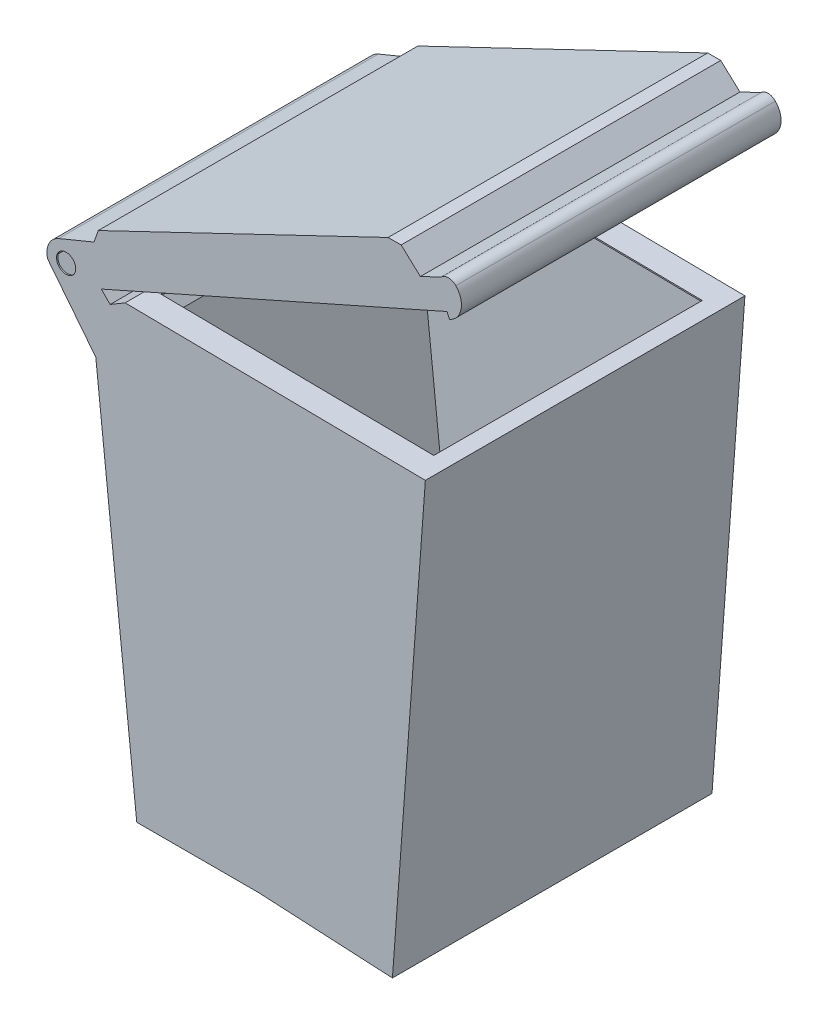
from build123d import *

# Parameters (mm, degrees)
BOSS_EXTRUDE1_DEPTH = 6.35
SHELL1_START        = 0.0254
SHELL1_DEPTH        = 6.2992
SKETCH3_W           = 5.418512696
SKETCH3_H           = 5.334
CUT_EXTRUDE2_DEPTH  = 1.524
SKETCH4_R           = 0.1905
CUT_EXTRUDE3_DEPTH  = 20.633989303


# Read off the part's stored shape, not the designer's step: Shell1
with BuildPart() as part:
    # Sketch1 → Boss-Extrude1 (new body)
    with BuildSketch(Plane.XY):
        with BuildLine():
            Line((7.716040042, 1.833305163), (10.375382868, 1.693751976))
            Line((10.375382868, 1.693751976), (11.029172055, 10.583751976))
            Line((11.029172055, 10.583751976), (5.064666493, 10.656097731))
            Line((5.064666493, 10.656097731), (4.767245057, 10.479252552))
            Line((4.767245057, 10.479252552), (4.590399878, 10.656097731))
            Line((4.590399878, 10.656097731), (11.46006589, 13.704368441))
            Line((11.46006589, 13.704368441), (11.509343406, 13.593315288))
            ThreePointArc((11.509343406, 13.593315288), (11.739536715, 13.882052013), (11.634947175, 14.236197299))
            ThreePointArc((11.634947175, 14.236197299), (11.492158572, 14.298396741), (11.347210136, 14.241411598))
            Line((11.347210136, 14.241411598), (10.931187512, 14.042030874))
            Line((10.931187512, 14.042030874), (10.548202312, 14.393751976))
            Line((10.548202312, 14.393751976), (10.290273504, 14.393751976))
            Line((10.290273504, 14.393751976), (4.530564215, 11.633385245))
            Line((4.530564215, 11.633385245), (4.445957531, 11.39304745))
            Line((4.445957531, 11.39304745), (3.74568803, 11.102479142))
            ThreePointArc((3.74568803, 11.102479142), (3.54655055, 10.911956466), (3.527947792, 10.636986353))
            Line((3.527947792, 10.636986353), (4.481389231, 9.429510304))
            Line((4.481389231, 9.429510304), (5.295382868, 1.833305163))
            Line((5.295382868, 1.833305163), (7.716040042, 1.833305163))
        make_face()
    extrude(amount=BOSS_EXTRUDE1_DEPTH)

    # Shell1 outline → Shell1 (cut)
    with BuildSketch(Plane.XY.offset(SHELL1_START)):
        with BuildLine():
            Line((5.318206472, 1.858705163), (7.716706036, 1.858705163))
            Line((7.716706036, 1.858705163), (10.351875533, 1.720420509))
            Line((10.351875533, 1.720420509), (11.001859717, 10.558681389))
            Line((11.001859717, 10.558681389), (5.071504797, 10.630612918))
            Line((5.071504797, 10.630612918), (4.76325019, 10.447326395))
            Line((4.76325019, 10.447326395), (4.546271575, 10.664305009))
            Line((4.546271575, 10.664305009), (11.472980817, 13.737887461))
            Line((11.472980817, 13.737887461), (11.521908422, 13.627622875))
            ThreePointArc((11.521908422, 13.627622875), (11.716832945, 13.899435369), (11.616664188, 14.218565158))
            ThreePointArc((11.616664188, 14.218565158), (11.489713166, 14.273025818), (11.362015112, 14.220340596))
            Line((11.362015112, 14.220340596), (10.926665769, 14.011697454))
            Line((10.926665769, 14.011697454), (10.538308623, 14.368351976))
            Line((10.538308623, 14.368351976), (10.296045707, 14.368351976))
            Line((10.296045707, 14.368351976), (4.551029407, 11.615026927))
            Line((4.551029407, 11.615026927), (4.466154882, 11.373928288))
            Line((4.466154882, 11.373928288), (3.755422691, 11.079018614))
            ThreePointArc((3.755422691, 11.079018614), (3.570543876, 10.903284548), (3.550847191, 10.64897238))
            Line((3.550847191, 10.64897238), (4.505864047, 9.439501161))
            Line((4.505864047, 9.439501161), (5.318206472, 1.858705163))
        make_face()
    extrude(amount=SHELL1_DEPTH, mode=Mode.SUBTRACT)

    # Sketch3 → Cut-Extrude2 (cut)
    with BuildSketch(Plane(origin=(0.12997786, 10.715952445, 0), x_dir=(0.9999264471855748, -0.012128487903857954, 0), z_dir=(0.012128487903857952, 0.9999264471855747, 0))):
        with Locations((7.850713163, -3.175)):
            Rectangle(SKETCH3_W, SKETCH3_H)
    extrude(amount=-CUT_EXTRUDE2_DEPTH, mode=Mode.SUBTRACT)

    # Sketch4 → Cut-Extrude3 (cut, through all)
    with BuildSketch(Plane.XY.offset(6.35)):
        with Locations((3.89174221, 10.750488628)):
            Circle(SKETCH4_R)
    extrude(amount=-CUT_EXTRUDE3_DEPTH, mode=Mode.SUBTRACT)


solid = part.part
